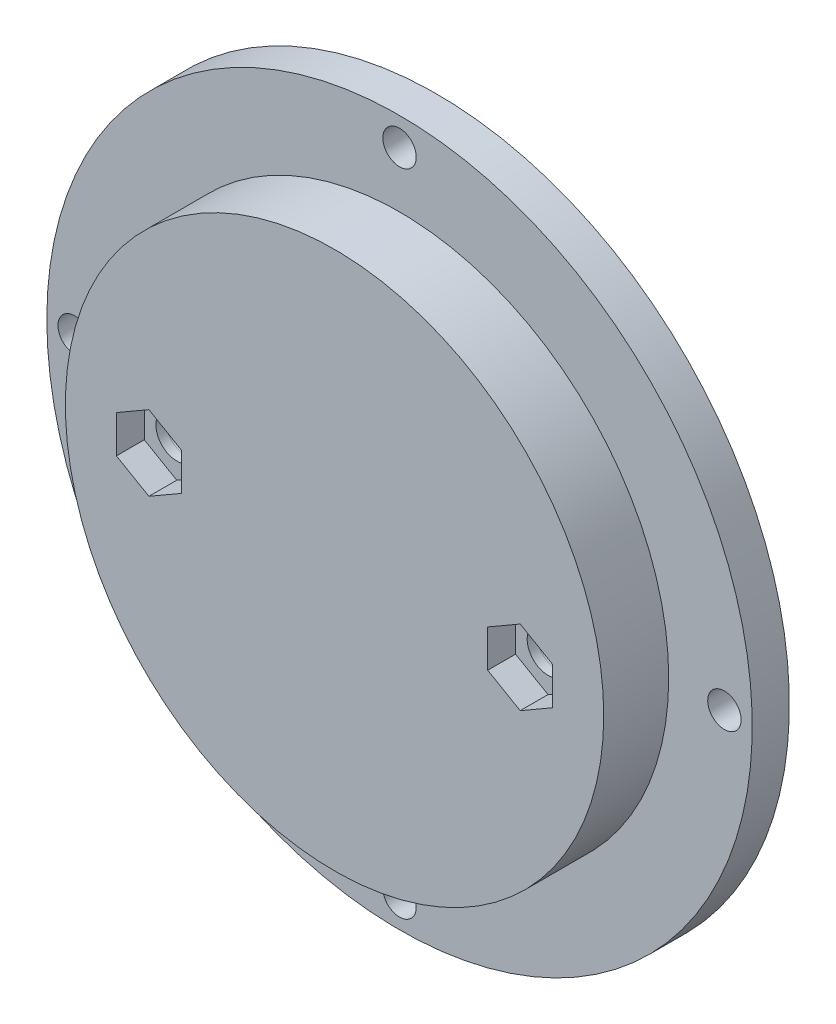
from build123d import *

# Parameters (mm, degrees)
SKETCH_2_R          = 2.25
EXTRUDE_1_DEPTH     = 1
SKETCH_3_R          = 14.1
EXTRUDE_2_DEPTH     = 14.35
FILLET_1_R          = 4
FILLET_2_R          = 2
SKETCH_5_R          = 29
EXTRUDE_3_DEPTH     = 7
EXTRUDE_START       = 4
SKETCH_6_R          = 29
SKETCH_6_R_2        = 2.25
EXTRUDE_4_DEPTH     = 4
SKETCH_7_R          = 38
SKETCH_7_R_2        = 1.8
SKETCH_7_R_3        = 29
EXTRUDE_5_DEPTH     = 4
CUT_EXTRUDE_1_DEPTH = 3


with BuildPart() as part:
    # ｽｹｯﾁ1 → 回転1 (revolve)
    with BuildSketch(Plane(origin=(0, 0, 0), x_dir=(1, 0, 0), z_dir=(0, 1, 0))):
        with BuildLine():
            Line((0, 1.7), (0, 19.9))
            ThreePointArc((0, 19.9), (9.1, 10.8), (0, 1.7))
        make_face()
    revolve(axis=Axis((0, 0, -1.7), (0, 0, -1)))



with BuildPart() as body_2:
    # ｽｹｯﾁ2 → ﾎﾞｽ - 押し出し1 (new body)
    with BuildSketch(Plane.XY):
        with BuildLine():
            Line((-24.008647874, 1.570418103), (-9.969615385, 12.641865728))
            ThreePointArc((-9.969615385, 12.641865728), (0, 16.1), (9.969615385, 12.641865728))
            Line((9.969615385, 12.641865728), (24.008647874, 1.570418103))
            ThreePointArc((24.008647874, 1.570418103), (24.770186335, 0), (24.008647874, -1.570418103))
            Line((24.008647874, -1.570418103), (9.969615385, -12.641865728))
            ThreePointArc((9.969615385, -12.641865728), (0, -16.1), (-9.969615385, -12.641865728))
            Line((-9.969615385, -12.641865728), (-24.008647874, -1.570418103))
            ThreePointArc((-24.008647874, -1.570418103), (-24.770186335, 0), (-24.008647874, 1.570418103))
        make_face()
        with Locations((-20, 0)):
            Circle(SKETCH_2_R, mode=Mode.SUBTRACT)
        with Locations((20, 0)):
            Circle(SKETCH_2_R, mode=Mode.SUBTRACT)
    extrude(amount=-EXTRUDE_1_DEPTH)


with BuildPart() as part_1:
    add(part.part)

    add(body_2.part)  # ﾎﾞｽ - 押し出し2 merges body 2
    # ｽｹｯﾁ3 → ﾎﾞｽ - 押し出し2 (add)
    with BuildSketch(Plane(origin=(0, 0, -1), x_dir=(-1, 0, 0), z_dir=(0, 0, -1))):
        Circle(SKETCH_3_R)
    extrude(amount=EXTRUDE_2_DEPTH)

    # ﾌｨﾚｯﾄ1
    fillet_1_edges = [part_1.edges().sort_by_distance(p)[0] for p in [
        (14.1, 0, -15.35),
    ]]
    fillet(fillet_1_edges, radius=FILLET_1_R)

    # ﾌｨﾚｯﾄ2
    fillet_2_edges = [part_1.edges().sort_by_distance(p)[0] for p in [
        (14.1, 0, -1),
    ]]
    fillet(fillet_2_edges, radius=FILLET_2_R - 0.0001)  # a hair under: the kernel refuses the full size


with BuildPart() as body_2_2:
    # ｽｹｯﾁ5 → ﾎﾞｽ - 押し出し3 (new body)
    with BuildSketch(Plane.XY):
        Circle(SKETCH_5_R)
        with BuildLine():
            Line((-10.898461538, 13.819679305), (-24.937494028, 2.74823168))
            ThreePointArc((-24.937494028, 2.74823168), (-26.270186335, 0), (-24.937494028, -2.74823168))
            Line((-24.937494028, -2.74823168), (-10.898461538, -13.819679305))
            ThreePointArc((-10.898461538, -13.819679305), (0, -17.6), (10.898461538, -13.819679305))
            Line((10.898461538, -13.819679305), (24.937494028, -2.74823168))
            ThreePointArc((24.937494028, -2.74823168), (26.270186335, 0), (24.937494028, 2.74823168))
            Line((24.937494028, 2.74823168), (10.898461538, 13.819679305))
            ThreePointArc((10.898461538, 13.819679305), (0, 17.6), (-10.898461538, 13.819679305))
        make_face(mode=Mode.SUBTRACT)
    extrude(amount=-EXTRUDE_3_DEPTH)

    # ｽｹｯﾁ6 → ﾎﾞｽ - 押し出し4 (add)
    with BuildSketch(Plane.XY.offset(EXTRUDE_START)):
        Circle(SKETCH_6_R)
        with Locations((20, 0)):
            Circle(SKETCH_6_R_2, mode=Mode.SUBTRACT)
        with Locations((-20, 0)):
            Circle(SKETCH_6_R_2, mode=Mode.SUBTRACT)
    extrude(amount=-EXTRUDE_4_DEPTH)

    # ｽｹｯﾁ7 → ﾎﾞｽ - 押し出し5 (add)
    with BuildSketch(Plane(origin=(0, 0, -7), x_dir=(-1, 0, 0), z_dir=(0, 0, -1))):
        Circle(SKETCH_7_R)
        with Locations((0, 35)):
            Circle(SKETCH_7_R_2, mode=Mode.SUBTRACT)
        with Locations((35, 0)):
            Circle(SKETCH_7_R_2, mode=Mode.SUBTRACT)
        with Locations((0, -35)):
            Circle(SKETCH_7_R_2, mode=Mode.SUBTRACT)
        with Locations((-35, 0)):
            Circle(SKETCH_7_R_2, mode=Mode.SUBTRACT)
        with Locations(Location((0, 0, 0), (0, 0, 180))):
            Circle(SKETCH_7_R_3, mode=Mode.SUBTRACT)
    extrude(amount=-EXTRUDE_5_DEPTH)

    # ｽｹｯﾁ8 → ｶｯﾄ - 押し出し1 (cut)
    with BuildSketch(Plane.XY.offset(4)):
        Polygon((-20, 4.041451884), (-23.5, 2.020725942), (-23.5, -2.020725942), (-20, -4.041451884), (-16.5, -2.020725942), (-16.5, 2.020725942), align=None)
        Polygon((20, 4.041451884), (16.5, 2.020725942), (16.5, -2.020725942), (20, -4.041451884), (23.5, -2.020725942), (23.5, 2.020725942), align=None)
    extrude(amount=-CUT_EXTRUDE_1_DEPTH, mode=Mode.SUBTRACT)


solid = Compound([part_1.part, body_2_2.part])
